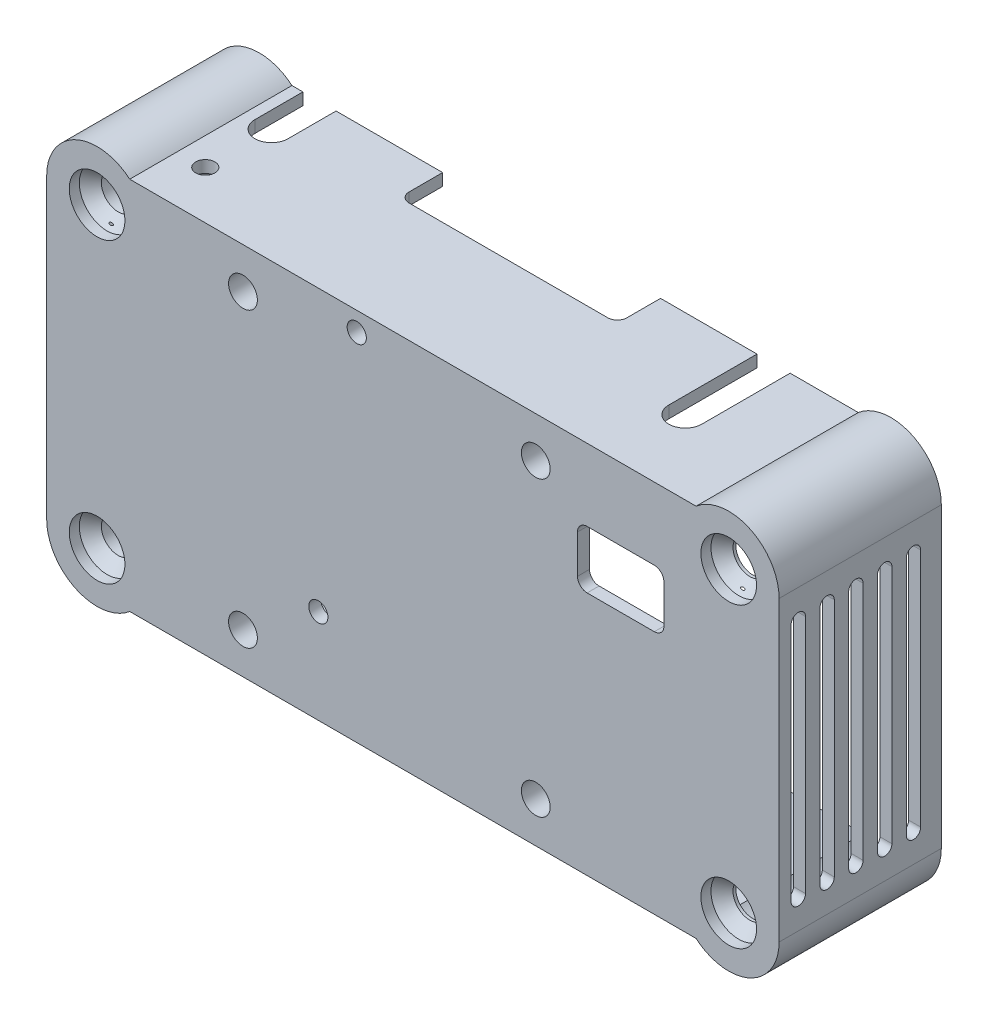
from build123d import *

# Parameters (mm, degrees)
SKETCH1_R           = 3.75
SKETCH1_R_2         = 1.75
BOSS_EXTRUDE1_DEPTH = 2.5
BOSS_EXTRUDE2_START = -2.5
BOSS_EXTRUDE2_DEPTH = 2.5
BOSS_EXTRUDE3_START = 14.4
BOSS_EXTRUDE3_DEPTH = 14.4
BOSS_EXTRUDE4_START = 6.75
SKETCH8_R           = 1.75
BOSS_EXTRUDE4_DEPTH = 6.75
CUT_EXTRUDE1_REACH  = 82.868
CUT_EXTRUDE2_REACH  = 59.559
SKETCH5_R           = 1.725
SKETCH6_R           = 1
CUT_EXTRUDE3_DEPTH  = 58.559407376
CUT_EXTRUDE4_REACH  = 49.768
SKETCH7_W           = 9
SKETCH7_H           = 6
SKETCH7_R           = 1
SKETCH9_R           = 2.9
CUT_EXTRUDE5_DEPTH  = 0.2
CHAMFER1_SIZE       = 2
SKETCH10_W          = 4.6
SKETCH10_H          = 4.5
SKETCH10_W_2        = 13.5
CUT_EXTRUDE6_DEPTH  = 58.559407376
FILLET1_R           = 1
SKETCH11_W          = 0.5
SKETCH11_H          = 13.07652834
BOSS_EXTRUDE5_DEPTH = 0.25
CUT_EXTRUDE7_REACH  = 49.768
SKETCH12_R          = 1.5
CUT_EXTRUDE8_REACH  = 82.868


with BuildPart() as part:
    # Sketch1 → Boss-Extrude1 (new body)
    # profile 1 of 5: a face of its own
    with BuildSketch(Plane.XY):
        with BuildLine():
            Line((30.499212629, 19.845090056), (-29.710617427, 19.845090056))
            ThreePointArc((-29.710617427, 19.845090056), (-29.002556053, 18.683172893), (-28.755702399, 17.345090056))
            ThreePointArc((-28.755702399, 17.345090056), (-32.505702399, 13.595090056), (-36.255702399, 17.345090056))
            Line((-36.255702399, 17.345090056), (-36.255702399, -13.654909944))
            ThreePointArc((-36.255702399, -13.654909944), (-32.505702399, -9.904909944), (-28.755702399, -13.654909944))
            ThreePointArc((-28.755702399, -13.654909944), (-29.002556053, -14.992992781), (-29.710617427, -16.154909944))
            Line((-29.710617427, -16.154909944), (30.499212629, -16.154909944))
            ThreePointArc((30.499212629, -16.154909944), (31.956214764, -10.151763598), (37.044297601, -13.654909944))
            Line((37.044297601, -13.654909944), (37.044297601, 17.345090056))
            ThreePointArc((37.044297601, 17.345090056), (31.956214764, 13.84194371), (30.499212629, 19.845090056))
        make_face()
    # profile 2 of 5: a face of its own
    with BuildSketch(Plane.XY):
        with Locations((-32.505702399, 17.345090056)):
            Circle(SKETCH1_R)
        with Locations((-32.505702399, 17.345090056)):
            Circle(SKETCH1_R_2, mode=Mode.SUBTRACT)
    # profile 3 of 5: a face of its own
    with BuildSketch(Plane.XY):
        with Locations((-32.505702399, -13.654909944)):
            Circle(SKETCH1_R)
        with Locations((-32.505702399, -13.654909944)):
            Circle(SKETCH1_R_2, mode=Mode.SUBTRACT)
    # profile 4 of 5: a face of its own
    with BuildSketch(Plane.XY):
        with Locations((33.294297601, 17.345090056)):
            Circle(SKETCH1_R)
        with Locations((33.294297601, 17.345090056)):
            Circle(SKETCH1_R_2, mode=Mode.SUBTRACT)
    # profile 5 of 5: a face of its own
    with BuildSketch(Plane.XY):
        with Locations((33.294297601, -13.654909944)):
            Circle(SKETCH1_R)
        with Locations((33.294297601, -13.654909944)):
            Circle(SKETCH1_R_2, mode=Mode.SUBTRACT)
    extrude(amount=BOSS_EXTRUDE1_DEPTH)

    # Sketch2 → Boss-Extrude2 (add)
    with BuildSketch(Plane.XY.offset(2.5).offset(BOSS_EXTRUDE2_START)):
        with BuildLine():
            Line((-37.755702399, 17.345090056), (-37.755702399, -13.654909944))
            ThreePointArc((-37.755702399, -13.654909944), (-34.70917352, -18.420118756), (-29.105334772, -17.654909944))
            Line((-29.105334772, -17.654909944), (29.893929974, -17.654909944))
            ThreePointArc((29.893929974, -17.654909944), (35.497768721, -18.420118756), (38.544297601, -13.654909944))
            Line((38.544297601, -13.654909944), (38.544297601, 17.345090056))
            ThreePointArc((38.544297601, 17.345090056), (35.497768721, 22.110298868), (29.893929974, 21.345090056))
            Line((29.893929974, 21.345090056), (-29.105334772, 21.345090056))
            ThreePointArc((-29.105334772, 21.345090056), (-34.70917352, 22.110298868), (-37.755702399, 17.345090056))
        make_face()
        with BuildLine():
            Line((-29.710617427, -16.154909944), (30.499212629, -16.154909944))
            ThreePointArc((30.499212629, -16.154909944), (34.632380437, -17.15805629), (37.044297601, -13.654909944))
            Line((37.044297601, -13.654909944), (37.044297601, 17.345090056))
            ThreePointArc((37.044297601, 17.345090056), (34.632380437, 20.848236402), (30.499212629, 19.845090056))
            Line((30.499212629, 19.845090056), (-29.710617427, 19.845090056))
            ThreePointArc((-29.710617427, 19.845090056), (-33.843785236, 20.848236402), (-36.255702399, 17.345090056))
            Line((-36.255702399, 17.345090056), (-36.255702399, -13.654909944))
            ThreePointArc((-36.255702399, -13.654909944), (-33.843785236, -17.15805629), (-29.710617427, -16.154909944))
        make_face(mode=Mode.SUBTRACT)
    extrude(amount=BOSS_EXTRUDE2_DEPTH)

    # Sketch3 → Boss-Extrude3 (add)
    with BuildSketch(Plane(origin=(0, 0, 0), x_dir=(-1, 0, 0), z_dir=(0, 0, -1)).offset(BOSS_EXTRUDE3_START)):
        with BuildLine():
            Line((29.105334772, 21.345090056), (-29.893929974, 21.345090056))
            ThreePointArc((-29.893929974, 21.345090056), (-35.497768721, 22.110298868), (-38.544297601, 17.345090056))
            Line((-38.544297601, 17.345090056), (-38.544297601, -13.654909944))
            ThreePointArc((-38.544297601, -13.654909944), (-35.497768721, -18.420118756), (-29.893929974, -17.654909944))
            Line((-29.893929974, -17.654909944), (29.105334772, -17.654909944))
            ThreePointArc((29.105334772, -17.654909944), (34.70917352, -18.420118756), (37.755702399, -13.654909944))
            Line((37.755702399, -13.654909944), (37.755702399, 17.345090056))
            ThreePointArc((37.755702399, 17.345090056), (34.70917352, 22.110298868), (29.105334772, 21.345090056))
        make_face()
        with BuildLine():
            Line((29.60096489, 20.095090056), (-30.389560091, 20.095090056))
            ThreePointArc((-30.389560091, 20.095090056), (-34.774339823, 21.061200256), (-37.294297601, 17.345090056))
            Line((-37.294297601, 17.345090056), (-37.294297601, -13.654909944))
            ThreePointArc((-37.294297601, -13.654909944), (-34.774339823, -17.371020144), (-30.389560091, -16.404909944))
            Line((-30.389560091, -16.404909944), (29.60096489, -16.404909944))
            ThreePointArc((29.60096489, -16.404909944), (33.985744622, -17.371020144), (36.505702399, -13.654909944))
            Line((36.505702399, -13.654909944), (36.505702399, 17.345090056))
            ThreePointArc((36.505702399, 17.345090056), (33.985744622, 21.061200256), (29.60096489, 20.095090056))
        make_face(mode=Mode.SUBTRACT)
    extrude(amount=-BOSS_EXTRUDE3_DEPTH)

    # Sketch8 → Boss-Extrude4 (add)
    # profile 1 of 3: a face of its own
    with BuildSketch(Plane(origin=(0, 0, 0), x_dir=(-1, 0, 0), z_dir=(0, 0, -1)).offset(BOSS_EXTRUDE4_START)):
        with BuildLine():
            ThreePointArc((29.105334772, 13.345090056), (32.929706516, 12.112239923), (36.505702399, 13.944722429))
            Line((36.505702399, 13.944722429), (36.505702399, 17.345090056))
            ThreePointArc((36.505702399, 17.345090056), (33.985744622, 21.061200256), (29.60096489, 20.095090056))
            Line((29.60096489, 20.095090056), (29.105334772, 20.095090056))
            Line((29.105334772, 20.095090056), (29.105334772, 13.345090056))
        make_face()
        with Locations(Location((32.505702399, 17.345090056, 0), (0, 0, 180))):
            Circle(SKETCH8_R, mode=Mode.SUBTRACT)
    # profile 2 of 3: a face of its own
    with BuildSketch(Plane(origin=(0, 0, 0), x_dir=(-1, 0, 0), z_dir=(0, 0, -1)).offset(BOSS_EXTRUDE4_START)):
        with BuildLine():
            Line((36.505702399, -10.254542317), (36.505702399, 13.944722429))
            ThreePointArc((36.505702399, 13.944722429), (32.929706516, 12.112239923), (29.105334772, 13.345090056))
            Line((29.105334772, 13.345090056), (29.105334772, -9.654909944))
            ThreePointArc((29.105334772, -9.654909944), (32.929706516, -8.422059812), (36.505702399, -10.254542317))
        make_face()
    # profile 3 of 3: a face of its own
    with BuildSketch(Plane(origin=(0, 0, 0), x_dir=(-1, 0, 0), z_dir=(0, 0, -1)).offset(BOSS_EXTRUDE4_START)):
        with BuildLine():
            Line((36.505702399, -13.654909944), (36.505702399, -10.254542317))
            ThreePointArc((36.505702399, -10.254542317), (32.929706516, -8.422059812), (29.105334772, -9.654909944))
            Line((29.105334772, -9.654909944), (29.105334772, -16.404909944))
            Line((29.105334772, -16.404909944), (29.60096489, -16.404909944))
            ThreePointArc((29.60096489, -16.404909944), (33.985744622, -17.371020144), (36.505702399, -13.654909944))
        make_face()
        with Locations(Location((32.505702399, -13.654909944, 0), (0, 0, 180))):
            Circle(SKETCH8_R, mode=Mode.SUBTRACT)
    extrude(amount=-BOSS_EXTRUDE4_DEPTH)

    # Sketch4 → Cut-Extrude1 (cut, up to next)
    with BuildSketch(Plane.ZY.offset(37.755702399), mode=Mode.PRIVATE) as cut_extrude1_sk1:
        Polygon((-11.9, -11.854909944), (-3.3, -11.854909944), (-3.3, 1.221618396), (-6.01069873, 4.245090056), (-9.18930127, 4.245090056), (-11.9, 1.221618396), align=None)
    cut_extrude1_tool1 = extrude(cut_extrude1_sk1.sketch, amount=-CUT_EXTRUDE1_REACH, mode=Mode.PRIVATE) & part.part
    add(cut_extrude1_tool1.solids().sort_by_distance((-37.755702, -4.247976, -7.6))[0], mode=Mode.SUBTRACT)

    # Sketch5 → Cut-Extrude2 (cut, up to next)
    with BuildSketch(Plane(origin=(0, 21.345090056, 0), x_dir=(1, 0, 0), z_dir=(0, 1, 0)), mode=Mode.PRIVATE) as cut_extrude2_sk1:
        with Locations((-26.235702399, 9.4)):
            Circle(SKETCH5_R)
    cut_extrude2_tool1 = extrude(cut_extrude2_sk1.sketch, amount=-CUT_EXTRUDE2_REACH, mode=Mode.PRIVATE) & part.part
    # Sketch5 → Cut-Extrude2 (cut, up to next)
    with BuildSketch(Plane(origin=(0, 21.345090056, 0), x_dir=(1, 0, 0), z_dir=(0, 1, 0)), mode=Mode.PRIVATE) as cut_extrude2_sk2:
        with BuildLine():
            Line((-27.960702399, 14.4), (-27.960702399, 9.4))
            ThreePointArc((-27.960702399, 9.4), (-26.235702399, 11.125), (-24.510702399, 9.4))
            Line((-24.510702399, 9.4), (-24.510702399, 14.4))
            Line((-24.510702399, 14.4), (-27.960702399, 14.4))
        make_face()
    cut_extrude2_tool2 = extrude(cut_extrude2_sk2.sketch, amount=-CUT_EXTRUDE2_REACH, mode=Mode.PRIVATE) & part.part
    # Sketch5 → Cut-Extrude2 (cut, up to next)
    with BuildSketch(Plane(origin=(0, 21.345090056, 0), x_dir=(1, 0, 0), z_dir=(0, 1, 0)), mode=Mode.PRIVATE) as cut_extrude2_sk3:
        with BuildLine():
            Line((22.794460332, 14.4), (19.344460332, 14.4))
            Line((19.344460332, 14.4), (19.344460332, 5.204680386))
            ThreePointArc((19.344460332, 5.204680386), (21.069460332, 6.929680386), (22.794460332, 5.204680386))
            Line((22.794460332, 5.204680386), (22.794460332, 14.4))
        make_face()
    cut_extrude2_tool3 = extrude(cut_extrude2_sk3.sketch, amount=-CUT_EXTRUDE2_REACH, mode=Mode.PRIVATE) & part.part
    # Sketch5 → Cut-Extrude2 (cut, up to next)
    with BuildSketch(Plane(origin=(0, 21.345090056, 0), x_dir=(1, 0, 0), z_dir=(0, 1, 0)), mode=Mode.PRIVATE) as cut_extrude2_sk4:
        with Locations((21.069460332, 5.204680386)):
            Circle(SKETCH5_R)
    cut_extrude2_tool4 = extrude(cut_extrude2_sk4.sketch, amount=-CUT_EXTRUDE2_REACH, mode=Mode.PRIVATE) & part.part
    add(cut_extrude2_tool1.solids().sort_by_distance((-26.235702, 21.34509, -9.4))[0], mode=Mode.SUBTRACT)
    add(cut_extrude2_tool2.solids().sort_by_distance((-26.235702, 21.34509, -12.557073))[0], mode=Mode.SUBTRACT)
    add(cut_extrude2_tool3.solids().sort_by_distance((21.06946, 21.34509, -10.470293))[0], mode=Mode.SUBTRACT)
    add(cut_extrude2_tool4.solids().sort_by_distance((21.06946, 21.34509, -5.20468))[0], mode=Mode.SUBTRACT)

    # Sketch6 → Cut-Extrude3 (cut, through all)
    with BuildSketch(Plane(origin=(0, 21.345090056, 0), x_dir=(1, 0, 0), z_dir=(0, 1, 0))):
        with Locations(Location((-26.235702399, 2.5, 0), (0, 0, 180))):
            Circle(SKETCH6_R)
    extrude(amount=-CUT_EXTRUDE3_DEPTH, mode=Mode.SUBTRACT)

    # Sketch7 → Cut-Extrude4 (cut, up to next)
    with BuildSketch(Plane.XY.offset(2.5), mode=Mode.PRIVATE) as cut_extrude4_sk1:
        with Locations((22.044297601, 10.845090056)):
            Rectangle(SKETCH7_W, SKETCH7_H)
    cut_extrude4_tool1 = extrude(cut_extrude4_sk1.sketch, amount=-CUT_EXTRUDE4_REACH, mode=Mode.PRIVATE) & part.part
    # Sketch7 → Cut-Extrude4 (cut, up to next)
    with BuildSketch(Plane.XY.offset(2.5), mode=Mode.PRIVATE) as cut_extrude4_sk2:
        with Locations((-5.455702399, 19.345090056)):
            Circle(SKETCH7_R)
    cut_extrude4_tool2 = extrude(cut_extrude4_sk2.sketch, amount=-CUT_EXTRUDE4_REACH, mode=Mode.PRIVATE) & part.part
    # Sketch7 → Cut-Extrude4 (cut, up to next)
    with BuildSketch(Plane.XY.offset(2.5), mode=Mode.PRIVATE) as cut_extrude4_sk3:
        with Locations((-9.455702399, -7.854909944)):
            Circle(SKETCH7_R)
    cut_extrude4_tool3 = extrude(cut_extrude4_sk3.sketch, amount=-CUT_EXTRUDE4_REACH, mode=Mode.PRIVATE) & part.part
    add(cut_extrude4_tool1.solids().sort_by_distance((22.044298, 10.84509, 2.5))[0], mode=Mode.SUBTRACT)
    add(cut_extrude4_tool2.solids().sort_by_distance((-5.455702, 19.34509, 2.5))[0], mode=Mode.SUBTRACT)
    add(cut_extrude4_tool3.solids().sort_by_distance((-9.455702, -7.85491, 2.5))[0], mode=Mode.SUBTRACT)

    # Sketch9 → Cut-Extrude5 (cut)
    with BuildSketch(Plane.XY.offset(2.5)):
        with Locations((-32.505702399, 17.345090056)):
            Circle(SKETCH9_R)
        with Locations((33.294297601, 17.345090056)):
            Circle(SKETCH9_R)
        with Locations((33.294297601, -13.654909944)):
            Circle(SKETCH9_R)
        with Locations((-32.505702399, -13.654909944)):
            Circle(SKETCH9_R)
    extrude(amount=-CUT_EXTRUDE5_DEPTH, mode=Mode.SUBTRACT)

    # Chamfer1
    # the kernel refuses this chamfer: 2 mm, written as the material it takes off along each edge
    with BuildSketch(Plane(origin=(33.294297601, -13.654909944, 2.3), x_dir=(1, 0, 0), z_dir=(0, 1, 0))) as chamfer1_piece_1_section:
        Polygon((1.75 + CHAMFER1_SIZE, 0), (1.75, CHAMFER1_SIZE), (1.75, 0), align=None)
    chamfer1_piece_1 = revolve(axis=Axis((33.294297601, -13.654909944, 2.3), (0, 0, -1)), mode=Mode.PRIVATE)
    chamfer1_piece_1 = chamfer1_piece_1 & Plane(origin=(33.294297601, -13.654909944, 0.867347815), x_dir=(1, 0, 0), z_dir=(0, 0, 1)) * Cylinder(2.9, 16, mode=Mode.PRIVATE)
    add(chamfer1_piece_1, mode=Mode.SUBTRACT)
    with BuildSketch(Plane(origin=(33.294297601, 17.345090056, 2.3), x_dir=(1, 0, 0), z_dir=(0, 1, 0))) as chamfer1_piece_2_section:
        Polygon((1.75, CHAMFER1_SIZE), (1.75 + CHAMFER1_SIZE, 0), (1.75, 0), align=None)
    chamfer1_piece_2 = revolve(axis=Axis((33.294297601, 17.345090056, 2.3), (0, 0, -1)), mode=Mode.PRIVATE)
    chamfer1_piece_2 = chamfer1_piece_2 & Plane(origin=(33.294297601, 17.345090056, 0.867347815), x_dir=(1, 0, 0), z_dir=(0, 0, 1)) * Cylinder(2.9, 16, mode=Mode.PRIVATE)
    add(chamfer1_piece_2, mode=Mode.SUBTRACT)
    with BuildSketch(Plane(origin=(-32.505702399, -13.654909944, 2.3), x_dir=(1, 0, 0), z_dir=(0, 1, 0))) as chamfer1_piece_3_section:
        Polygon((1.75, CHAMFER1_SIZE), (1.75 + CHAMFER1_SIZE, 0), (1.75, 0), align=None)
    chamfer1_piece_3 = revolve(axis=Axis((-32.505702399, -13.654909944, 2.3), (0, 0, -1)), mode=Mode.PRIVATE)
    chamfer1_piece_3 = chamfer1_piece_3 & Plane(origin=(-32.505702399, -13.654909944, 0.867347815), x_dir=(1, 0, 0), z_dir=(0, 0, 1)) * Cylinder(2.9, 15, mode=Mode.PRIVATE)
    add(chamfer1_piece_3, mode=Mode.SUBTRACT)
    with BuildSketch(Plane(origin=(-32.505702399, 17.345090056, 2.3), x_dir=(1, 0, 0), z_dir=(0, 1, 0))) as chamfer1_piece_4_section:
        Polygon((1.75 + CHAMFER1_SIZE, 0), (1.75, CHAMFER1_SIZE), (1.75, 0), align=None)
    chamfer1_piece_4 = revolve(axis=Axis((-32.505702399, 17.345090056, 2.3), (0, 0, -1)), mode=Mode.PRIVATE)
    chamfer1_piece_4 = chamfer1_piece_4 & Plane(origin=(-32.505702399, 17.345090056, 0.867347815), x_dir=(1, 0, 0), z_dir=(0, 0, 1)) * Cylinder(2.9, 15, mode=Mode.PRIVATE)
    add(chamfer1_piece_4, mode=Mode.SUBTRACT)

    # Sketch10 → Cut-Extrude6 (cut, through all)
    with BuildSketch(Plane(origin=(0, 21.345090056, 0), x_dir=(1, 0, 0), z_dir=(0, 1, 0))):
        with Locations((-11.105702399, 12.15)):
            Rectangle(SKETCH10_W, SKETCH10_H)
        with Locations((-2.055702399, 12.15)):
            Rectangle(SKETCH10_W_2, SKETCH10_H)
        with Locations((6.994297601, 12.15)):
            Rectangle(SKETCH10_W, SKETCH10_H)
    extrude(amount=-CUT_EXTRUDE6_DEPTH, mode=Mode.SUBTRACT)

    # Fillet1
    fillet1_edges = [part.edges().sort_by_distance(p)[0] for p in [
        (17.544297601, 7.845090056, 1.25),
        (17.544297601, 13.845090056, 1.25),
        (26.544297601, 13.845090056, 1.25),
        (26.544297601, 7.845090056, 1.25),
        (-13.405702399, 20.720090056, -9.9),
        (9.294297601, -17.029909944, -9.9),
        (9.294297601, 20.720090056, -9.9),
        (-13.405702399, -17.029909944, -9.9),
    ]]
    fillet(fillet1_edges, radius=FILLET1_R)

    # Sketch11 → Boss-Extrude5 (add)
    with BuildSketch(Plane(origin=(0, 0, -3.3), x_dir=(-1, 0, 0), z_dir=(0, 0, -1))):
        with Locations((32.805518586, -5.316645774)):
            Rectangle(SKETCH11_W, SKETCH11_H)
    extrude(amount=BOSS_EXTRUDE5_DEPTH)

    # Sketch12 → Cut-Extrude7 (cut, up to next)
    with BuildSketch(Plane.XY.offset(2.5), mode=Mode.PRIVATE) as cut_extrude7_sk1:
        with Locations((-17.305702399, 17.095090056)):
            Circle(SKETCH12_R)
    cut_extrude7_tool1 = extrude(cut_extrude7_sk1.sketch, amount=-CUT_EXTRUDE7_REACH, mode=Mode.PRIVATE) & part.part
    # Sketch12 → Cut-Extrude7 (cut, up to next)
    with BuildSketch(Plane.XY.offset(2.5), mode=Mode.PRIVATE) as cut_extrude7_sk2:
        with Locations((13.194297601, 17.095090056)):
            Circle(SKETCH12_R)
    cut_extrude7_tool2 = extrude(cut_extrude7_sk2.sketch, amount=-CUT_EXTRUDE7_REACH, mode=Mode.PRIVATE) & part.part
    # Sketch12 → Cut-Extrude7 (cut, up to next)
    with BuildSketch(Plane.XY.offset(2.5), mode=Mode.PRIVATE) as cut_extrude7_sk3:
        with Locations((13.194297601, -13.404909944)):
            Circle(SKETCH12_R)
    cut_extrude7_tool3 = extrude(cut_extrude7_sk3.sketch, amount=-CUT_EXTRUDE7_REACH, mode=Mode.PRIVATE) & part.part
    # Sketch12 → Cut-Extrude7 (cut, up to next)
    with BuildSketch(Plane.XY.offset(2.5), mode=Mode.PRIVATE) as cut_extrude7_sk4:
        with Locations((-17.305702399, -13.404909944)):
            Circle(SKETCH12_R)
    cut_extrude7_tool4 = extrude(cut_extrude7_sk4.sketch, amount=-CUT_EXTRUDE7_REACH, mode=Mode.PRIVATE) & part.part
    add(cut_extrude7_tool1.solids().sort_by_distance((-17.305702, 17.09509, 2.5))[0], mode=Mode.SUBTRACT)
    add(cut_extrude7_tool2.solids().sort_by_distance((13.194298, 17.09509, 2.5))[0], mode=Mode.SUBTRACT)
    add(cut_extrude7_tool3.solids().sort_by_distance((13.194298, -13.40491, 2.5))[0], mode=Mode.SUBTRACT)
    add(cut_extrude7_tool4.solids().sort_by_distance((-17.305702, -13.40491, 2.5))[0], mode=Mode.SUBTRACT)

    # Sketch13 → Cut-Extrude8 (cut, up to next)
    with BuildSketch(Plane(origin=(38.544297601, 0, 0), x_dir=(0, 0, -1), z_dir=(1, 0, 0)), mode=Mode.PRIVATE) as cut_extrude8_sk1:
        with BuildLine():
            Line((0.25, 14.345090056), (0.25, -10.654909944))
            ThreePointArc((0.25, -10.654909944), (-0.5, -11.404909944), (-1.25, -10.654909944))
            Line((-1.25, -10.654909944), (-1.25, 14.345090056))
            ThreePointArc((-1.25, 14.345090056), (-0.5, 15.095090056), (0.25, 14.345090056))
        make_face()
    cut_extrude8_tool1 = extrude(cut_extrude8_sk1.sketch, amount=-CUT_EXTRUDE8_REACH, mode=Mode.PRIVATE) & part.part
    # Sketch13 → Cut-Extrude8 (cut, up to next)
    with BuildSketch(Plane(origin=(38.544297601, 0, 0), x_dir=(0, 0, -1), z_dir=(1, 0, 0)), mode=Mode.PRIVATE) as cut_extrude8_sk2:
        with BuildLine():
            Line((3.25, 14.345090056), (3.25, -10.654909944))
            ThreePointArc((3.25, -10.654909944), (2.5, -11.404909944), (1.75, -10.654909944))
            Line((1.75, -10.654909944), (1.75, 14.345090056))
            ThreePointArc((1.75, 14.345090056), (2.5, 15.095090056), (3.25, 14.345090056))
        make_face()
    cut_extrude8_tool2 = extrude(cut_extrude8_sk2.sketch, amount=-CUT_EXTRUDE8_REACH, mode=Mode.PRIVATE) & part.part
    # Sketch13 → Cut-Extrude8 (cut, up to next)
    with BuildSketch(Plane(origin=(38.544297601, 0, 0), x_dir=(0, 0, -1), z_dir=(1, 0, 0)), mode=Mode.PRIVATE) as cut_extrude8_sk3:
        with BuildLine():
            Line((6.25, 14.345090056), (6.25, -10.654909944))
            ThreePointArc((6.25, -10.654909944), (5.5, -11.404909944), (4.75, -10.654909944))
            Line((4.75, -10.654909944), (4.75, 14.345090056))
            ThreePointArc((4.75, 14.345090056), (5.5, 15.095090056), (6.25, 14.345090056))
        make_face()
    cut_extrude8_tool3 = extrude(cut_extrude8_sk3.sketch, amount=-CUT_EXTRUDE8_REACH, mode=Mode.PRIVATE) & part.part
    # Sketch13 → Cut-Extrude8 (cut, up to next)
    with BuildSketch(Plane(origin=(38.544297601, 0, 0), x_dir=(0, 0, -1), z_dir=(1, 0, 0)), mode=Mode.PRIVATE) as cut_extrude8_sk4:
        with BuildLine():
            Line((9.25, 14.345090056), (9.25, -10.654909944))
            ThreePointArc((9.25, -10.654909944), (8.5, -11.404909944), (7.75, -10.654909944))
            Line((7.75, -10.654909944), (7.75, 14.345090056))
            ThreePointArc((7.75, 14.345090056), (8.5, 15.095090056), (9.25, 14.345090056))
        make_face()
    cut_extrude8_tool4 = extrude(cut_extrude8_sk4.sketch, amount=-CUT_EXTRUDE8_REACH, mode=Mode.PRIVATE) & part.part
    # Sketch13 → Cut-Extrude8 (cut, up to next)
    with BuildSketch(Plane(origin=(38.544297601, 0, 0), x_dir=(0, 0, -1), z_dir=(1, 0, 0)), mode=Mode.PRIVATE) as cut_extrude8_sk5:
        with BuildLine():
            Line((12.25, 14.345090056), (12.25, -10.654909944))
            ThreePointArc((12.25, -10.654909944), (11.5, -11.404909944), (10.75, -10.654909944))
            Line((10.75, -10.654909944), (10.75, 14.345090056))
            ThreePointArc((10.75, 14.345090056), (11.5, 15.095090056), (12.25, 14.345090056))
        make_face()
    cut_extrude8_tool5 = extrude(cut_extrude8_sk5.sketch, amount=-CUT_EXTRUDE8_REACH, mode=Mode.PRIVATE) & part.part
    add(cut_extrude8_tool1.solids().sort_by_distance((38.544298, 1.84509, 0.5))[0], mode=Mode.SUBTRACT)
    add(cut_extrude8_tool2.solids().sort_by_distance((38.544298, 1.84509, -2.5))[0], mode=Mode.SUBTRACT)
    add(cut_extrude8_tool3.solids().sort_by_distance((38.544298, 1.84509, -5.5))[0], mode=Mode.SUBTRACT)
    add(cut_extrude8_tool4.solids().sort_by_distance((38.544298, 1.84509, -8.5))[0], mode=Mode.SUBTRACT)
    add(cut_extrude8_tool5.solids().sort_by_distance((38.544298, 1.84509, -11.5))[0], mode=Mode.SUBTRACT)


solid = part.part
